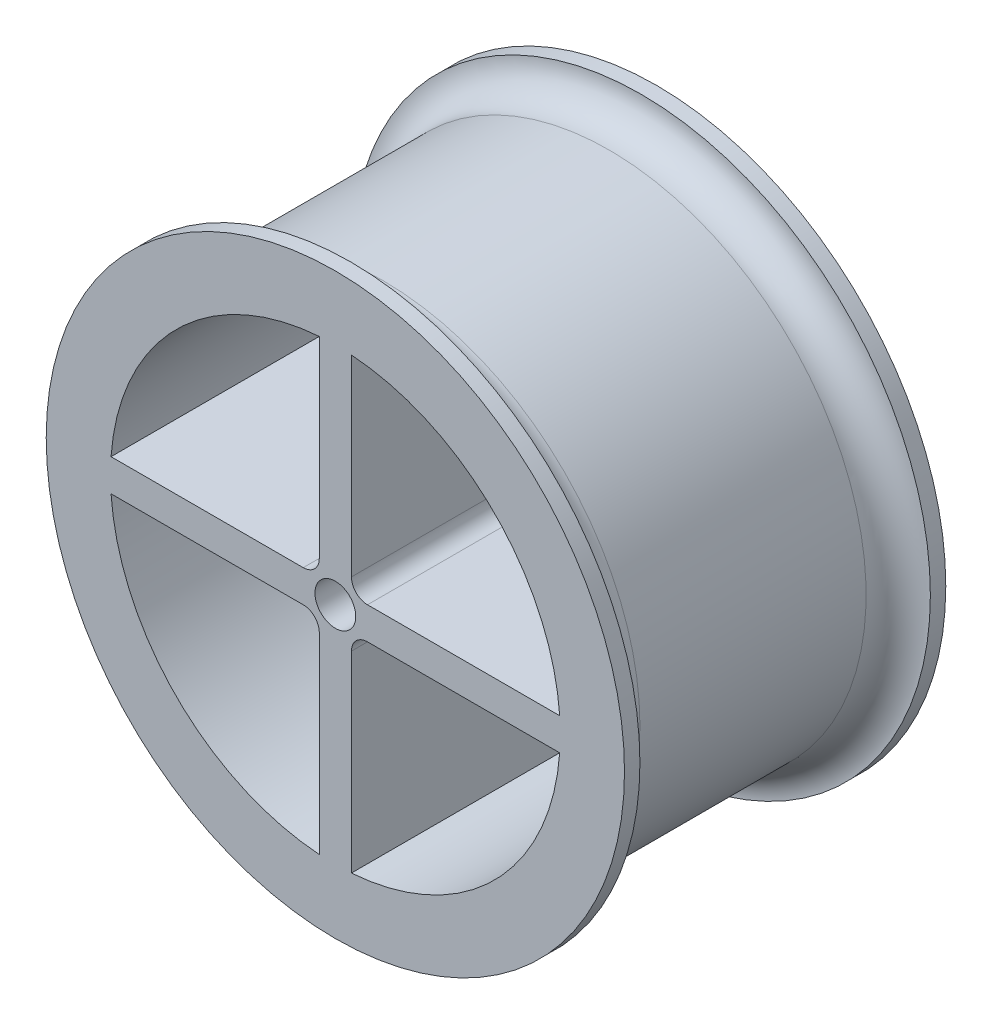
from build123d import *

# Parameters (mm, degrees)
BOSS_EXTRUDE6_DEPTH  = 25
SKETCH2_R            = 45
SKETCH2_R_2          = 40
BOSS_EXTRUDE7_DEPTH  = 2.4
FILLET1_R            = 2.5
FILLET2_R            = 5
FILLET2_OF_MIRROR1_R = 5


with BuildPart() as part:
    # Sketch1 → Boss-Extrude6 (new, symmetric)
    with BuildSketch(Plane.XY):
        with BuildLine():
            Line((-34.910600109, -2.5), (-39.921798557, -2.5))
            ThreePointArc((-39.921798557, -2.5), (-28.284271247, -28.284271247), (-2.5, -39.921798557))
            Line((-2.5, -39.921798557), (-2.5, -34.910600109))
            ThreePointArc((-2.5, -34.910600109), (-24.748737342, -24.748737342), (-34.910600109, -2.5))
        make_face()
        with BuildLine():
            Line((-2.5, 34.910600109), (-2.5, 39.921798557))
            ThreePointArc((-2.5, 39.921798557), (-28.284271247, 28.284271247), (-39.921798557, 2.5))
            Line((-39.921798557, 2.5), (-34.910600109, 2.5))
            ThreePointArc((-34.910600109, 2.5), (-24.748737342, 24.748737342), (-2.5, 34.910600109))
        make_face()
        with BuildLine():
            Line((-34.910600109, 2.5), (-39.921798557, 2.5))
            Line((-39.921798557, 2.5), (-39.921798557, -2.5))
            Line((-39.921798557, -2.5), (-34.910600109, -2.5))
            ThreePointArc((-34.910600109, -2.5), (-35, 0), (-34.910600109, 2.5))
        make_face()
        with BuildLine():
            Line((-2.5, 1.957198253), (-2.5, 2.5))
            Line((-2.5, 2.5), (-34.910600109, 2.5))
            ThreePointArc((-34.910600109, 2.5), (-35, 0), (-34.910600109, -2.5))
            Line((-34.910600109, -2.5), (-2.5, -2.5))
            Line((-2.5, -2.5), (-2.5, -1.957198253))
            ThreePointArc((-2.5, -1.957198253), (-3.175, 0), (-2.5, 1.957198253))
        make_face()
        with BuildLine():
            Line((2.5, 39.921798557), (-2.5, 39.921798557))
            Line((-2.5, 39.921798557), (-2.5, 34.910600109))
            ThreePointArc((-2.5, 34.910600109), (0, 35), (2.5, 34.910600109))
            Line((2.5, 34.910600109), (2.5, 39.921798557))
        make_face()
        with BuildLine():
            ThreePointArc((2.5, 34.910600109), (0, 35), (-2.5, 34.910600109))
            Line((-2.5, 34.910600109), (-2.5, 2.5))
            Line((-2.5, 2.5), (-1.957198253, 2.5))
            ThreePointArc((-1.957198253, 2.5), (0, 3.175), (1.957198253, 2.5))
            Line((1.957198253, 2.5), (2.5, 2.5))
            Line((2.5, 2.5), (2.5, 34.910600109))
        make_face()
        with BuildLine():
            ThreePointArc((39.921798557, 2.5), (28.284271247, 28.284271247), (2.5, 39.921798557))
            Line((2.5, 39.921798557), (2.5, 34.910600109))
            ThreePointArc((2.5, 34.910600109), (24.748737342, 24.748737342), (34.910600109, 2.5))
            Line((34.910600109, 2.5), (39.921798557, 2.5))
        make_face()
        with BuildLine():
            Line((39.921798557, -2.5), (39.921798557, 2.5))
            Line((39.921798557, 2.5), (34.910600109, 2.5))
            ThreePointArc((34.910600109, 2.5), (34.977642887, 1.250798979), (35, 0))
            ThreePointArc((35, 0), (34.977642887, -1.250798979), (34.910600109, -2.5))
            Line((34.910600109, -2.5), (39.921798557, -2.5))
        make_face()
        with BuildLine():
            ThreePointArc((2.5, -39.921798557), (28.284271247, -28.284271247), (39.921798557, -2.5))
            Line((39.921798557, -2.5), (34.910600109, -2.5))
            ThreePointArc((34.910600109, -2.5), (24.748737342, -24.748737342), (2.5, -34.910600109))
            Line((2.5, -34.910600109), (2.5, -39.921798557))
        make_face()
        with BuildLine():
            Line((34.910600109, 2.5), (2.5, 2.5))
            Line((2.5, 2.5), (2.5, 1.957198253))
            ThreePointArc((2.5, 1.957198253), (3.001510037, 1.035163031), (3.175, 0))
            ThreePointArc((3.175, 0), (3.001510037, -1.035163031), (2.5, -1.957198253))
            Line((2.5, -1.957198253), (2.5, -2.5))
            Line((2.5, -2.5), (34.910600109, -2.5))
            ThreePointArc((34.910600109, -2.5), (34.977642887, -1.250798979), (35, 0))
            ThreePointArc((35, 0), (34.977642887, 1.250798979), (34.910600109, 2.5))
        make_face()
        with BuildLine():
            Line((-1.957198253, -2.5), (-2.5, -2.5))
            Line((-2.5, -2.5), (-2.5, -34.910600109))
            ThreePointArc((-2.5, -34.910600109), (0, -35), (2.5, -34.910600109))
            Line((2.5, -34.910600109), (2.5, -2.5))
            Line((2.5, -2.5), (1.957198253, -2.5))
            ThreePointArc((1.957198253, -2.5), (0, -3.175), (-1.957198253, -2.5))
        make_face()
        with BuildLine():
            Line((-2.5, -34.910600109), (-2.5, -39.921798557))
            Line((-2.5, -39.921798557), (2.5, -39.921798557))
            Line((2.5, -39.921798557), (2.5, -34.910600109))
            ThreePointArc((2.5, -34.910600109), (0, -35), (-2.5, -34.910600109))
        make_face()
        with BuildLine():
            Line((-39.921798557, -2.5), (-39.921798557, 2.5))
            ThreePointArc((-39.921798557, 2.5), (-40, 0), (-39.921798557, -2.5))
        make_face()
        with BuildLine():
            Line((2.5, -39.921798557), (-2.5, -39.921798557))
            ThreePointArc((-2.5, -39.921798557), (0, -40), (2.5, -39.921798557))
        make_face()
        with BuildLine():
            ThreePointArc((40, 0), (39.980444859, 1.250611397), (39.921798557, 2.5))
            Line((39.921798557, 2.5), (39.921798557, -2.5))
            ThreePointArc((39.921798557, -2.5), (39.980444859, -1.250611397), (40, 0))
        make_face()
        with BuildLine():
            ThreePointArc((2.5, 39.921798557), (0, 40), (-2.5, 39.921798557))
            Line((-2.5, 39.921798557), (2.5, 39.921798557))
        make_face()
        with BuildLine():
            Line((-1.957198253, 2.5), (-2.5, 2.5))
            Line((-2.5, 2.5), (-2.5, 1.957198253))
            ThreePointArc((-2.5, 1.957198253), (-2.24506403, 2.24506403), (-1.957198253, 2.5))
        make_face()
        with BuildLine():
            Line((2.5, 1.957198253), (2.5, 2.5))
            Line((2.5, 2.5), (1.957198253, 2.5))
            ThreePointArc((1.957198253, 2.5), (2.24506403, 2.24506403), (2.5, 1.957198253))
        make_face()
        with BuildLine():
            Line((2.5, -2.5), (2.5, -1.957198253))
            ThreePointArc((2.5, -1.957198253), (2.24506403, -2.24506403), (1.957198253, -2.5))
            Line((1.957198253, -2.5), (2.5, -2.5))
        make_face()
        with BuildLine():
            ThreePointArc((-1.957198253, -2.5), (-2.24506403, -2.24506403), (-2.5, -1.957198253))
            Line((-2.5, -1.957198253), (-2.5, -2.5))
            Line((-2.5, -2.5), (-1.957198253, -2.5))
        make_face()
    extrude(amount=BOSS_EXTRUDE6_DEPTH, both=True)

    # Sketch2 → Boss-Extrude7 (add)
    with BuildSketch(Plane.XY.offset(25)):
        Circle(SKETCH2_R)
        Circle(SKETCH2_R_2, mode=Mode.SUBTRACT)
    boss_extrude7 = extrude(amount=-BOSS_EXTRUDE7_DEPTH)

    # Fillet1
    fillet1_edges = [part.edges().sort_by_distance(p)[0] for p in [
        (-2.5, -2.5, 0),
        (2.5, -2.5, 0),
        (-2.5, 2.5, 0),
        (2.5, 2.5, 0),
    ]]
    fillet(fillet1_edges, radius=FILLET1_R)

    # Fillet2
    fillet2_edges = [part.edges().sort_by_distance(p)[0] for p in [
        (-2.5, -39.921798557, 22.6),
    ]]
    fillet(fillet2_edges, radius=FILLET2_R - 0.0001)  # a hair under: the kernel refuses the full size

    # Mirror1: Boss-Extrude7 across plane
    add(boss_extrude7.mirror(Plane.XY))

    # Fillet2 of Mirror1
    fillet2_of_mirror1_edges = [part.edges().sort_by_distance(p)[0] for p in [
        (-2.5, -39.921798557, -22.6),
    ]]
    fillet(fillet2_of_mirror1_edges, radius=FILLET2_OF_MIRROR1_R - 0.0001)  # a hair under: the kernel refuses the full size


solid = part.part
